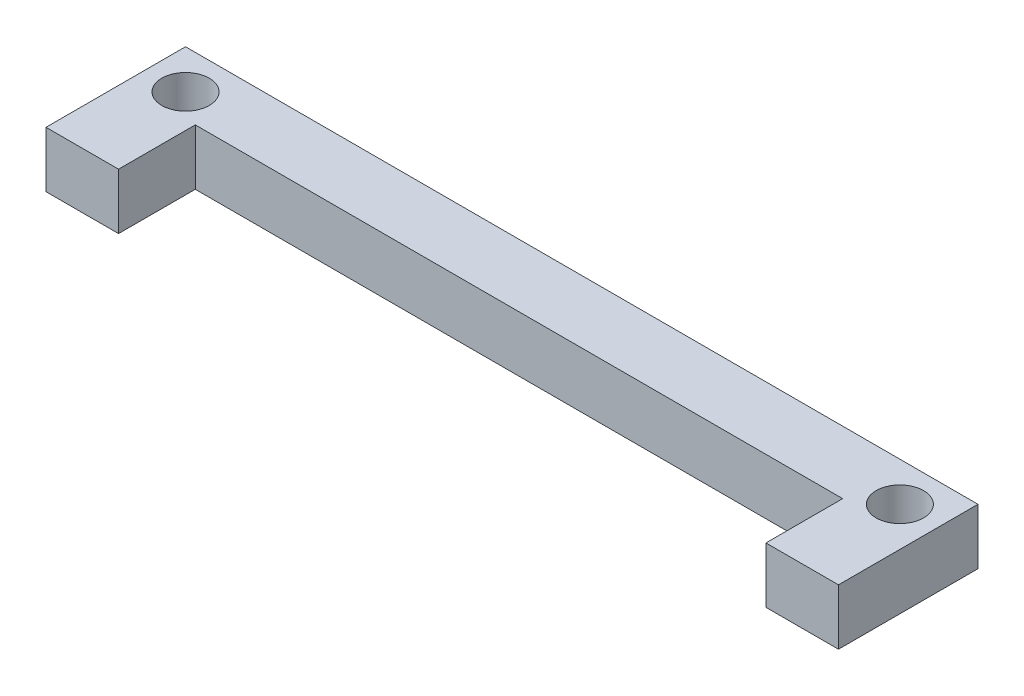
from build123d import *

# Parameters (mm, degrees)
SKETCH1_R           = 4.25
BOSS_EXTRUDE1_DEPTH = 10


with BuildPart() as part:
    # Sketch1 → Boss-Extrude1 (new body)
    with BuildSketch(Plane(origin=(0, 0, 0), x_dir=(1, 0, 0), z_dir=(0, 1, 0))):
        Polygon((-71, 11.25), (71, 11.25), (71, 0), (71, -13.75), (58, -13.75), (58, 0), (-58, 0), (-58, -13.75), (-71, -13.75), align=None)
        with Locations((-64, 4.25)):
            Circle(SKETCH1_R, mode=Mode.SUBTRACT)
        with Locations((64, 4.25)):
            Circle(SKETCH1_R, mode=Mode.SUBTRACT)
    extrude(amount=BOSS_EXTRUDE1_DEPTH)


solid = part.part
